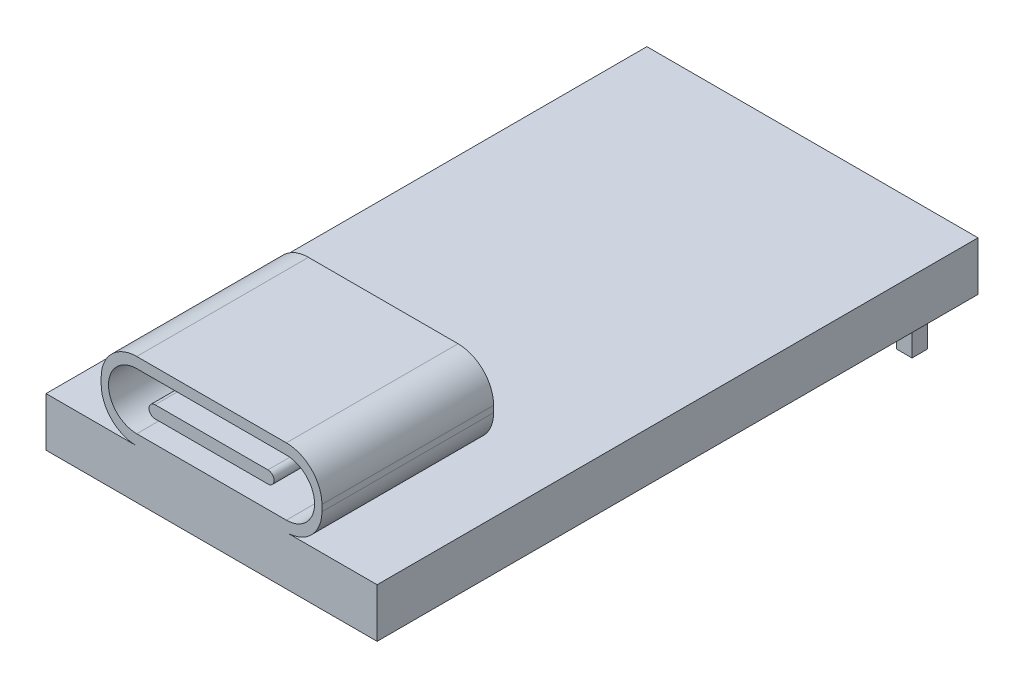
from build123d import *

# Parameters (mm, degrees)
SKETCH1_W           = 13.5
SKETCH1_H           = 24.5
BOSS_EXTRUDE1_DEPTH = 2
SKETCH2_W           = 9
SKETCH2_H           = 7
BOSS_EXTRUDE2_DEPTH = 3.16
CUT_EXTRUDE1_DEPTH  = 7.16
CUT_EXTRUDE2_DEPTH  = 2.16
CUT_EXTRUDE3_DEPTH  = 2.16
SKETCH7_W           = 0.64
SKETCH7_H           = 0.64
BOSS_EXTRUDE3_DEPTH = 2


with BuildPart() as part:
    # Sketch1 → Boss-Extrude1 (new body)
    with BuildSketch(Plane(origin=(0, 0, 0), x_dir=(1, 0, 0), z_dir=(0, 1, 0))):
        with Locations((6.75, 12.25)):
            Rectangle(SKETCH1_W, SKETCH1_H)
    extrude(amount=BOSS_EXTRUDE1_DEPTH)

    # Sketch2 → Boss-Extrude2 (add)
    with BuildSketch(Plane(origin=(0, 2, 0), x_dir=(1, 0, 0), z_dir=(0, 1, 0))):
        with Locations((6.75, 3.5)):
            Rectangle(SKETCH2_W, SKETCH2_H)
    extrude(amount=BOSS_EXTRUDE2_DEPTH)

    # Sketch3 → Cut-Extrude1 (cut)
    with BuildSketch(Plane.XY):
        with BuildLine():
            ThreePointArc((11.25, 3.45), (10.825304833, 2.424695167), (9.8, 2))
            Line((9.8, 2), (11.25, 2))
            Line((11.25, 2), (11.25, 3.45))
        make_face()
        with BuildLine():
            Line((2.25, 2), (3.7, 2))
            ThreePointArc((3.7, 2), (2.674695167, 2.424695167), (2.25, 3.45))
            Line((2.25, 3.45), (2.25, 2))
        make_face()
        with BuildLine():
            ThreePointArc((9.8, 5.16), (10.825304833, 4.735304833), (11.25, 3.71))
            Line((11.25, 3.71), (11.25, 5.16))
            Line((11.25, 5.16), (9.8, 5.16))
        make_face()
        with BuildLine():
            Line((2.25, 5.16), (2.25, 3.71))
            ThreePointArc((2.25, 3.71), (2.674695167, 4.735304833), (3.7, 5.16))
            Line((3.7, 5.16), (2.25, 5.16))
        make_face()
    extrude(amount=-CUT_EXTRUDE1_DEPTH, mode=Mode.SUBTRACT)

    # Sketch4 → Cut-Extrude2 (cut)
    with BuildSketch(Plane.XY):
        with BuildLine():
            Line((3.7, 4.73), (9.8, 4.73))
            ThreePointArc((9.8, 4.73), (10.95, 3.58), (9.8, 2.43))
            Line((9.8, 2.43), (3.7, 2.43))
            ThreePointArc((3.7, 2.43), (2.55, 3.58), (3.7, 4.73))
        make_face()
        with BuildLine():
            Line((3.7, 3.83), (9.8, 3.83))
            ThreePointArc((9.8, 3.83), (10.05, 3.58), (9.8, 3.33))
            Line((9.8, 3.33), (3.7, 3.33))
            ThreePointArc((3.7, 3.33), (3.45, 3.58), (3.7, 3.83))
        make_face(mode=Mode.SUBTRACT)
    extrude(amount=-CUT_EXTRUDE2_DEPTH, mode=Mode.SUBTRACT)

    # Sketch5 → Cut-Extrude3 (cut)
    with BuildSketch(Plane.XY):
        with BuildLine():
            ThreePointArc((4.45, 3.33), (4.2, 3.58), (4.45, 3.83))
            Line((4.45, 3.83), (3.7, 3.83))
            ThreePointArc((3.7, 3.83), (3.45, 3.58), (3.7, 3.33))
            Line((3.7, 3.33), (4.45, 3.33))
        make_face()
        with BuildLine():
            Line((9.8, 3.83), (9.05, 3.83))
            ThreePointArc((9.05, 3.83), (9.3, 3.58), (9.05, 3.33))
            Line((9.05, 3.33), (9.8, 3.33))
            ThreePointArc((9.8, 3.33), (10.05, 3.58), (9.8, 3.83))
        make_face()
    extrude(amount=-CUT_EXTRUDE3_DEPTH, mode=Mode.SUBTRACT)

    # Sketch7 → Boss-Extrude3 (add)
    with BuildSketch(Plane.XZ):
        with Locations((1.92, -23.23)):
            Rectangle(SKETCH7_W, SKETCH7_H)
        with Locations((4.46, -23.23)):
            Rectangle(SKETCH7_W, SKETCH7_H)
        with Locations((7, -23.23)):
            Rectangle(SKETCH7_W, SKETCH7_H)
        with Locations((9.54, -23.23)):
            Rectangle(SKETCH7_W, SKETCH7_H)
        with Locations((12.08, -23.23)):
            Rectangle(SKETCH7_W, SKETCH7_H)
    extrude(amount=BOSS_EXTRUDE3_DEPTH)


solid = part.part
